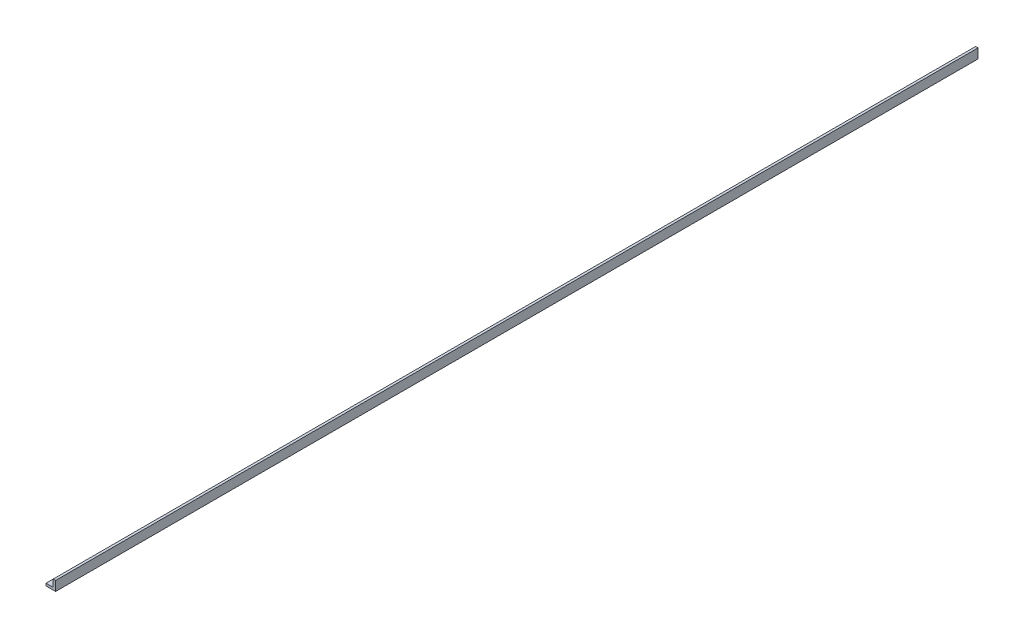
from build123d import *

# Parameters (mm, degrees)
BOSS_EXTRUDE1_DEPTH = 609.6


with BuildPart() as part:
    # Sketch2 → Boss-Extrude1 (new, symmetric)
    with BuildSketch(Plane.XY):
        Polygon((-6.35, 0), (6.35, 0), (6.35, 12.7), (3.175, 12.7), (3.175, 3.175), (-6.35, 3.175), align=None)
    extrude(amount=BOSS_EXTRUDE1_DEPTH, both=True)


solid = part.part
